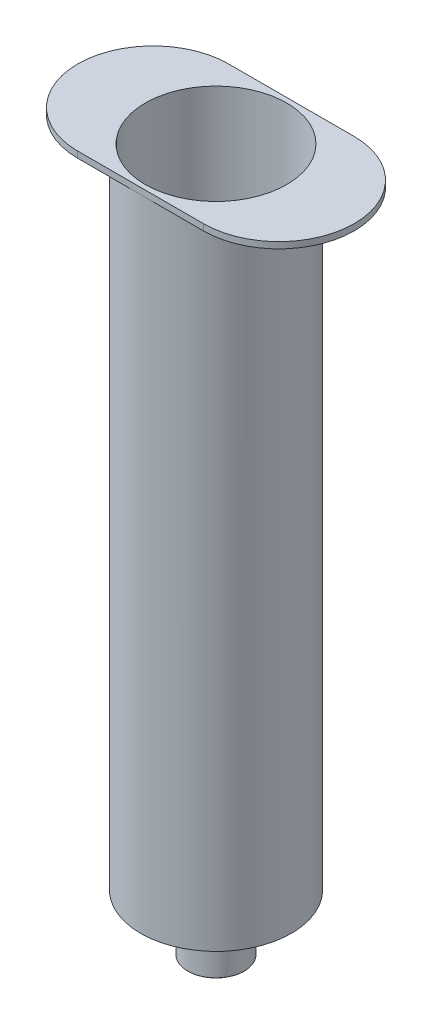
from build123d import *

# Parameters (mm, degrees)
SKETCH1_R           = 12
BOSS_EXTRUDE1_DEPTH = 105
SKETCH2_R           = 11.25
CUT_EXTRUDE2_DEPTH  = 102
CHAMFER3_SIZE       = 12
CHAMFER3_SIZE2      = 3.215390309
SKETCH3_R           = 1
CUT_EXTRUDE3_DEPTH  = 116
SKETCH4_R           = 4.5
SKETCH4_R_2         = 4
BOSS_EXTRUDE2_DEPTH = 1
BOSS_EXTRUDE3_START = 6.04
SKETCH5_R           = 4.5
SKETCH5_R_2         = 4
BOSS_EXTRUDE3_DEPTH = 6.04
SKETCH6_R           = 1.4
SKETCH6_R_2         = 1
BOSS_EXTRUDE4_DEPTH = 7
FILLET1_R           = 0.2
FILLET2_R           = 0.05
FILLET3_R           = 0.05
BOSS_EXTRUDE5_START = 1
SKETCH7_R           = 11.25
BOSS_EXTRUDE5_DEPTH = 1


with BuildPart() as part:
    # Sketch1 → Boss-Extrude1 (new body)
    with BuildSketch(Plane(origin=(0, 0, 0), x_dir=(1, 0, 0), z_dir=(0, 1, 0))):
        Circle(SKETCH1_R)
    extrude(amount=BOSS_EXTRUDE1_DEPTH)

    # Sketch2 → Cut-Extrude2 (cut)
    with BuildSketch(Plane(origin=(0, 105, 0), x_dir=(1, 0, 0), z_dir=(0, 1, 0))):
        Circle(SKETCH2_R)
    extrude(amount=-CUT_EXTRUDE2_DEPTH, mode=Mode.SUBTRACT)

    # Chamfer3
    chamfer3_edges = [part.edges().sort_by_distance(p)[0] for p in [
        (-12, 0, 0),
    ]]
    chamfer3_side = [part.faces().sort_by_distance(p)[0] for p in [
        (0, 0, 0),
    ]]
    chamfer(chamfer3_edges, length=CHAMFER3_SIZE, length2=CHAMFER3_SIZE2, reference=chamfer3_side[0])

    # Sketch3 → Cut-Extrude3 (cut)
    with BuildSketch(Plane(origin=(0, 105, 0), x_dir=(1, 0, 0), z_dir=(0, 1, 0))):
        Circle(SKETCH3_R)
    extrude(amount=-CUT_EXTRUDE3_DEPTH, mode=Mode.SUBTRACT)

    # Sketch4 → Boss-Extrude2 (add)
    with BuildSketch(Plane(origin=(0, 0.267949192, 0), x_dir=(1, 0, 0), z_dir=(0, 1, 0))):
        Circle(SKETCH4_R)
        Circle(SKETCH4_R_2, mode=Mode.SUBTRACT)
    extrude(amount=BOSS_EXTRUDE2_DEPTH)

    # Sketch5 → Boss-Extrude3 (add)
    with BuildSketch(Plane.XZ.offset(-0.267949192).offset(BOSS_EXTRUDE3_START)):
        Circle(SKETCH5_R)
        Circle(SKETCH5_R_2, mode=Mode.SUBTRACT)
    extrude(amount=-BOSS_EXTRUDE3_DEPTH)

    # Fillet2
    fillet2_edges = [part.edges().sort_by_distance(p)[0] for p in [
        (-4.5, -5.772050808, 0),
    ]]
    fillet(fillet2_edges, radius=FILLET2_R)

    # Fillet3
    fillet3_edges = [part.edges().sort_by_distance(p)[0] for p in [
        (-4, -5.772050808, 0),
    ]]
    fillet(fillet3_edges, radius=FILLET3_R)

    # Sketch7 → Boss-Extrude5 (add)
    with BuildSketch(Plane(origin=(0, 105, 0), x_dir=(1, 0, 0), z_dir=(0, 1, 0)).offset(BOSS_EXTRUDE5_START)):
        with BuildLine():
            Line((-10, 12), (10, 12))
            ThreePointArc((10, 12), (22, 0), (10, -12))
            Line((10, -12), (-10, -12))
            ThreePointArc((-10, -12), (-22, 0), (-10, 12))
        make_face()
        Circle(SKETCH7_R, mode=Mode.SUBTRACT)
    extrude(amount=-BOSS_EXTRUDE5_DEPTH)


with BuildPart() as body_2:
    # Sketch6 → Boss-Extrude4 (new body)
    with BuildSketch(Plane(origin=(0, 0.267949192, 0), x_dir=(1, 0, 0), z_dir=(0, 1, 0))):
        Circle(SKETCH6_R)
        Circle(SKETCH6_R_2, mode=Mode.SUBTRACT)
    extrude(amount=-BOSS_EXTRUDE4_DEPTH)

    # Fillet1
    fillet1_edges = [body_2.edges().sort_by_distance(p)[0] for p in [
        (-1.4, -6.732050808, 0),
    ]]
    fillet(fillet1_edges, radius=FILLET1_R)


solid = Compound([part.part, body_2.part])
